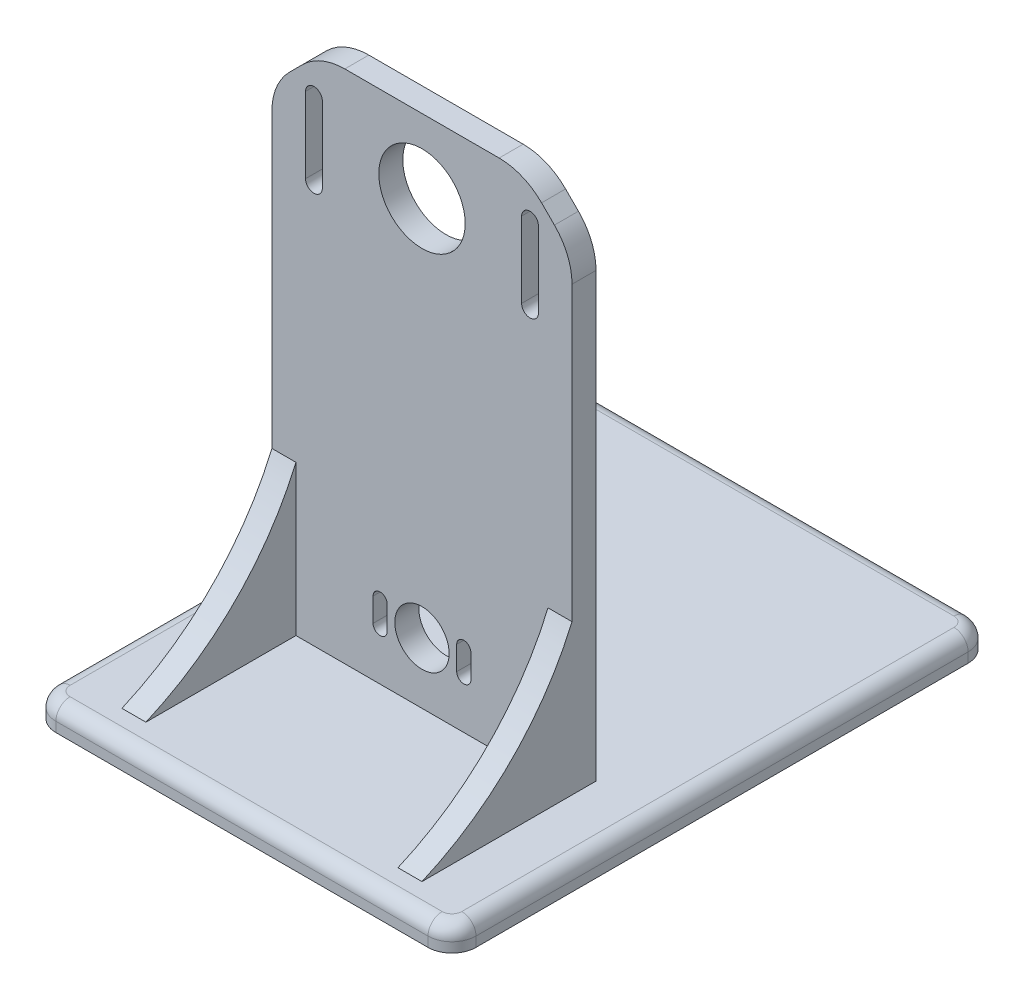
from build123d import *

# Parameters (mm, degrees)
SKETCH1_W                  = 88.9
SKETCH1_H                  = 114.3
BASE_DEPTH                 = 5.08
SKETCH2_W                  = 63.5
SKETCH2_H                  = 5.08
FACE_PLATE_DEPTH           = 114.3
SKETCH3_W                  = 5.08
SKETCH3_H                  = 31.75
BACK_FACE_SUPPORTS_DEPTH   = 31.75
BF_EXTRA_SUPPORT_CUT_DEPTH = 153.722450543
SKETCH5_R                  = 9.144
SKETCH5_R_2                = 5.75
FACE_HOLES_DEPTH           = 149.437956399
BASE_CORNER_FILLET_R       = 5.08
SKETCH9_W                  = 63.5
SKETCH9_H                  = 5.284393904
BASE_REFINE_DEPTH          = 149.437956399
FACE_REFINE_CUT_DEPTH      = 145.222223774
TOP_FACE_FILLET_R          = 12.7
NAME_DEPTH                 = 0.508
BOTTOM_CUT_DEPTH           = 2.54
FILLET1_R                  = 3
CUT_EXTRUDE1_DEPTH         = 0.4


with BuildPart() as part:
    # Sketch1 → Base (new body)
    with BuildSketch(Plane(origin=(0, 0, 0), x_dir=(1, 0, 0), z_dir=(0, 1, 0))):
        Rectangle(SKETCH1_W, SKETCH1_H)
    extrude(amount=BASE_DEPTH)

    # Sketch2 → Face Plate (add)
    with BuildSketch(Plane(origin=(0, 5.08, 0), x_dir=(1, 0, 0), z_dir=(0, 1, 0))):
        with Locations((0, -16.51)):
            Rectangle(SKETCH2_W, SKETCH2_H)
    extrude(amount=FACE_PLATE_DEPTH)

    # Sketch3 → Back Face Supports (add)
    with BuildSketch(Plane.XY.offset(19.05)):
        with Locations((-29.21, 20.955)):
            Rectangle(SKETCH3_W, SKETCH3_H)
        with Locations((29.21, 20.955)):
            Rectangle(SKETCH3_W, SKETCH3_H)
    extrude(amount=BACK_FACE_SUPPORTS_DEPTH)

    # Sketch4 → BF Extra Support Cut (cut, through all)
    with BuildSketch(Plane(origin=(31.75, 0, 0), x_dir=(0, 0, -1), z_dir=(1, 0, 0))):
        with BuildLine():
            Line((-50.8, 5.08), (-50.8, 36.83))
            Line((-50.8, 36.83), (-19.05, 36.83))
            ThreePointArc((-19.05, 36.83), (-31.87137494, 17.90137494), (-50.8, 5.08))
        make_face()
    extrude(amount=-BF_EXTRA_SUPPORT_CUT_DEPTH, mode=Mode.SUBTRACT)

    # Sketch5 → Face Holes (cut, through all)
    with BuildSketch(Plane.XY.offset(19.05)):
        with Locations((0, 98.498)):
            Circle(SKETCH5_R)
        with Locations((0, 17.98)):
            Circle(SKETCH5_R_2)
        with BuildLine():
            Line((-10.35, 15.48), (-10.35, 20.48))
            ThreePointArc((-10.35, 20.48), (-8.85, 21.98), (-7.35, 20.48))
            Line((-7.35, 20.48), (-7.35, 15.48))
            ThreePointArc((-7.35, 15.48), (-8.85, 13.98), (-10.35, 15.48))
        make_face()
        with BuildLine():
            Line((10.35, 20.48), (10.35, 15.48))
            ThreePointArc((10.35, 15.48), (8.85, 13.98), (7.35, 15.48))
            Line((7.35, 15.48), (7.35, 20.48))
            ThreePointArc((7.35, 20.48), (8.85, 21.98), (10.35, 20.48))
        make_face()
        with BuildLine():
            Line((24.638, 105.83), (24.638, 89.83))
            ThreePointArc((24.638, 89.83), (22.86, 88.052), (21.082, 89.83))
            Line((21.082, 89.83), (21.082, 105.83))
            ThreePointArc((21.082, 105.83), (22.86, 107.608), (24.638, 105.83))
        make_face()
        with BuildLine():
            Line((-21.082, 105.83), (-21.082, 89.83))
            ThreePointArc((-21.082, 89.83), (-22.86, 88.052), (-24.638, 89.83))
            Line((-24.638, 89.83), (-24.638, 105.83))
            ThreePointArc((-24.638, 105.83), (-22.86, 107.608), (-21.082, 105.83))
        make_face()
    extrude(amount=-FACE_HOLES_DEPTH, mode=Mode.SUBTRACT)

    # Base Corner Fillet
    base_corner_fillet_edges = [part.edges().sort_by_distance(p)[0] for p in [
        (-44.45, 2.54, -57.15),
        (44.45, 2.54, -57.15),
        (44.45, 2.54, 57.15),
        (-44.45, 2.54, 57.15),
    ]]
    fillet(base_corner_fillet_edges, radius=BASE_CORNER_FILLET_R)

    # Sketch9 → Base Refine (cut, through all)
    with BuildSketch(Plane.XY.offset(19.05)):
        with Locations((0, 116.737803048)):
            Rectangle(SKETCH9_W, SKETCH9_H)
    extrude(amount=-BASE_REFINE_DEPTH, mode=Mode.SUBTRACT)

    # Sketch10 → Face Refine Cut (cut, through all)
    with BuildSketch(Plane.XY.offset(19.05)):
        Polygon((-31.75, 103.935606096), (-21.59, 114.095606096), (-31.75, 114.095606096), align=None)
        Polygon((21.59, 114.095606096), (31.75, 103.935606096), (31.75, 114.095606096), align=None)
    extrude(amount=-FACE_REFINE_CUT_DEPTH, mode=Mode.SUBTRACT)

    # Top Face Fillet
    top_face_fillet_edges = [part.edges().sort_by_distance(p)[0] for p in [
        (-21.59, 114.095606096, 16.51),
        (-31.75, 103.935606096, 16.51),
        (21.59, 114.095606096, 16.51),
        (31.75, 103.935606096, 16.51),
    ]]
    fillet(top_face_fillet_edges, radius=TOP_FACE_FILLET_R)

    # Sketch16 → Name (cut)
    # profile 1 of 7: a face of its own
    with BuildSketch(Plane(origin=(0, 0, 13.97), x_dir=(-1, 0, 0), z_dir=(0, 0, -1))):
        with BuildLine():
            Line((-12.471962698, 66.783231191), (-10.945308385, 66.863581418))
            Line((-10.945308385, 66.863581418), (-10.945308385, 63.723645202))
            add(Edge.make_bspline(
                [(-10.945308385, 63.723645202), (-10.894257328, 63.788353863), (-10.795330555, 63.913746351), (-10.630590311, 64.078338575), (-10.462433111, 64.219764676), (-10.286710754, 64.333469949), (-10.105483231, 64.42249593), (-9.91933376, 64.487057121), (-9.727050145, 64.526336575), (-9.597111789, 64.531050085), (-9.531646578, 64.533424834)],
                knots=[0, 0, 0, 0, 1.168822825, 2.264945695, 3.29838973, 4.281884798, 5.227492406, 6.157224656, 7.071577621, 8, 8, 8, 8], degree=3))
            add(Edge.make_bspline(
                [(-9.531646578, 64.533424834), (-9.470396033, 64.531238682), (-9.350344183, 64.526953797), (-9.174871834, 64.493587463), (-9.008877972, 64.437586153), (-8.906999532, 64.382576052), (-8.856202482, 64.355147768)],
                knots=[0, 0, 0, 0, 1.039340968, 2.037121574, 3.02129996, 4, 4, 4, 4], degree=3))
            add(Edge.make_bspline(
                [(-8.856202482, 64.355147768), (-8.817352658, 64.328507232), (-8.736854496, 64.273307131), (-8.634346067, 64.158251635), (-8.538703847, 64.020491366), (-8.453056013, 63.858009515), (-8.381659419, 63.674209992), (-8.331090551, 63.472206503), (-8.298574037, 63.254313369), (-8.295395005, 63.103565493), (-8.293750893, 63.025602605)],
                knots=[0, 0, 0, 0, 0.750912499, 1.555916367, 2.445224318, 3.430216918, 4.485397544, 5.590808741, 6.754028823, 8, 8, 8, 8], degree=3))
            Line((-8.293750893, 63.025602605), (-8.293750893, 61.177547383))
            add(Edge.make_bspline(
                [(-8.293750893, 61.177547383), (-8.292599789, 61.149823314), (-8.290427929, 61.097514542), (-8.273080475, 61.024859657), (-8.244228053, 60.963798639), (-8.202314441, 60.914959785), (-8.146896621, 60.879007422), (-8.078688841, 60.85440263), (-7.9976614, 60.839724113), (-7.939356415, 60.838151491), (-7.908320897, 60.837314391)],
                knots=[0, 0, 0, 0, 1.12071811, 2.114530431, 3.000515668, 3.828803179, 4.683494856, 5.642662726, 6.745198504, 8, 8, 8, 8], degree=3))
            Line((-7.908320897, 60.837314391), (-7.570598849, 60.837314391))
            Line((-7.570598849, 60.837314391), (-7.570598849, 60.515913482))
            Line((-7.570598849, 60.515913482), (-9.740054979, 60.515913482))
            Line((-9.740054979, 60.515913482), (-9.740054979, 60.837314391))
            Line((-9.740054979, 60.837314391), (-9.50025977, 60.837314391))
            add(Edge.make_bspline(
                [(-9.50025977, 60.837314391), (-9.457916154, 60.83792309), (-9.380378663, 60.839037709), (-9.274482674, 60.855356026), (-9.188823193, 60.880117697), (-9.12191949, 60.917505304), (-9.073142169, 60.967546004), (-9.040504723, 61.028620777), (-9.019485734, 61.099604595), (-9.017795933, 61.150598833), (-9.016902936, 61.177547383)],
                knots=[0, 0, 0, 0, 1.493786353, 2.735346083, 3.772994554, 4.627205296, 5.411016843, 6.204796016, 7.051301753, 8, 8, 8, 8], degree=3))
            Line((-9.016902936, 61.177547383), (-9.016902936, 63.02309166))
            add(Edge.make_bspline(
                [(-9.016902936, 63.02309166), (-9.01753335, 63.062465508), (-9.018756717, 63.138873397), (-9.030907469, 63.250341838), (-9.04758296, 63.355452634), (-9.072653257, 63.453853427), (-9.10550589, 63.545059543), (-9.145672486, 63.629744916), (-9.193787985, 63.707588013), (-9.247404138, 63.779645438), (-9.30768241, 63.842611799), (-9.370724854, 63.89987233), (-9.44033467, 63.944981148), (-9.511934329, 63.985707156), (-9.589145592, 64.013451986), (-9.66963219, 64.035405559), (-9.754188773, 64.049797862), (-9.812396931, 64.050812064), (-9.841748235, 64.051323472)],
                knots=[0, 0, 0, 0, 1.274887751, 2.474014809, 3.628403139, 4.719955398, 5.757655449, 6.764162974, 7.749917439, 8.717800625, 9.667185997, 10.570042641, 11.468615002, 12.348172181, 13.231897901, 14.116454972, 15.050227598, 16, 16, 16, 16], degree=3))
            add(Edge.make_bspline(
                [(-9.841748235, 64.051323472), (-9.887885352, 64.049136093), (-9.979719402, 64.044782205), (-10.1153995, 64.01760687), (-10.244466578, 63.966384602), (-10.369730913, 63.900565325), (-10.487158058, 63.813105937), (-10.594532482, 63.70462248), (-10.692711481, 63.576540839), (-10.779887866, 63.431615749), (-10.854836257, 63.275599968), (-10.905097692, 63.110322054), (-10.940362454, 62.941724196), (-10.943656795, 62.827001485), (-10.945308385, 62.769486256)],
                knots=[0, 0, 0, 0, 0.887841407, 1.767212146, 2.646288066, 3.550259555, 4.482464879, 5.450143428, 6.477428723, 7.579135646, 8.699130984, 9.796447035, 10.895267977, 12, 12, 12, 12], degree=3))
            Line((-10.945308385, 62.769486256), (-10.945308385, 61.218977969))
            add(Edge.make_bspline(
                [(-10.945308385, 61.218977969), (-10.944821988, 61.186631742), (-10.943922311, 61.126801667), (-10.925567048, 61.044660193), (-10.899034194, 60.976242757), (-10.858746567, 60.921626579), (-10.80348158, 60.882565704), (-10.735654836, 60.855382689), (-10.653518046, 60.839297048), (-10.59427354, 60.838008085), (-10.562389334, 60.837314391)],
                knots=[0, 0, 0, 0, 1.231192412, 2.277308443, 3.193625701, 4.014386126, 4.825616126, 5.741933384, 6.784753784, 8, 8, 8, 8], degree=3))
            Line((-10.562389334, 60.837314391), (-10.222156341, 60.837314391))
            Line((-10.222156341, 60.837314391), (-10.222156341, 60.515913482))
            Line((-10.222156341, 60.515913482), (-12.391612471, 60.515913482))
            Line((-12.391612471, 60.515913482), (-12.391612471, 60.837314391))
            Line((-12.391612471, 60.837314391), (-12.140518012, 60.837314391))
            add(Edge.make_bspline(
                [(-12.140518012, 60.837314391), (-12.100695553, 60.838454998), (-12.02687582, 60.840569366), (-11.92499666, 60.857182378), (-11.841376786, 60.886677704), (-11.775040047, 60.929436905), (-11.725159358, 60.985917508), (-11.691655206, 61.055443098), (-11.671011482, 61.137036021), (-11.669347325, 61.195404073), (-11.668460428, 61.226510803)],
                knots=[0, 0, 0, 0, 1.353048536, 2.508174669, 3.493670835, 4.345741896, 5.161920022, 6.020612883, 6.945103361, 8, 8, 8, 8], degree=3))
            Line((-11.668460428, 61.226510803), (-11.668460428, 65.958385891))
            add(Edge.make_bspline(
                [(-11.668460428, 65.958385891), (-11.670167181, 65.998249447), (-11.673364623, 66.072930089), (-11.696362911, 66.178190019), (-11.739769625, 66.266374635), (-11.799122848, 66.338916373), (-11.874062441, 66.396078144), (-11.965350285, 66.433937668), (-12.070577256, 66.458726848), (-12.145795726, 66.460754294), (-12.185715014, 66.461830283)],
                knots=[0, 0, 0, 0, 1.159054976, 2.171381103, 3.107337103, 3.989130834, 4.874944922, 5.817599636, 6.841775591, 8, 8, 8, 8], degree=3))
            Line((-12.185715014, 66.461830283), (-12.471962698, 66.461830283))
            Line((-12.471962698, 66.461830283), (-12.471962698, 66.783231191))
        make_face()
    # profile 2 of 7: a face of its own
    with BuildSketch(Plane(origin=(0, 0, 13.97), x_dir=(-1, 0, 0), z_dir=(0, 0, -1))):
        with BuildLine():
            Line((-4.43945094, 66.863581418), (-4.059042834, 66.863581418))
            Line((-4.059042834, 66.863581418), (-1.892097649, 61.188846634))
            add(Edge.make_bspline(
                [(-1.892097649, 61.188846634), (-1.879975161, 61.160779003), (-1.856694173, 61.106875696), (-1.808467999, 61.034663792), (-1.75263499, 60.972420461), (-1.685596331, 60.923612974), (-1.611986593, 60.882767597), (-1.527455131, 60.858294235), (-1.435554812, 60.839014928), (-1.37077757, 60.837895181), (-1.337178893, 60.837314391)],
                knots=[0, 0, 0, 0, 1.039787226, 1.996889935, 2.945563617, 3.872445737, 4.810232727, 5.797866669, 6.857796924, 8, 8, 8, 8], degree=3))
            Line((-1.337178893, 60.837314391), (-1.142580687, 60.837314391))
            Line((-1.142580687, 60.837314391), (-1.142580687, 60.515913482))
            Line((-1.142580687, 60.515913482), (-3.713787952, 60.515913482))
            Line((-3.713787952, 60.515913482), (-3.713787952, 60.837314391))
            Line((-3.713787952, 60.837314391), (-3.509145967, 60.837314391))
            add(Edge.make_bspline(
                [(-3.509145967, 60.837314391), (-3.447135025, 60.83791634), (-3.332486718, 60.839029249), (-3.175680056, 60.855697651), (-3.046105563, 60.878404117), (-2.973960624, 60.908995482), (-2.941672489, 60.922686507)],
                knots=[0, 0, 0, 0, 1.28614417, 2.377874675, 3.274025287, 4, 4, 4, 4], degree=3))
            add(Edge.make_bspline(
                [(-2.941672489, 60.922686507), (-2.924728275, 60.933163254), (-2.891820888, 60.953510162), (-2.853871541, 60.997031661), (-2.833195348, 61.050367684), (-2.830221755, 61.087821545), (-2.828679982, 61.107240934)],
                knots=[0, 0, 0, 0, 1.044845995, 2.029197152, 2.978161746, 4, 4, 4, 4], degree=3))
            add(Edge.make_bspline(
                [(-2.828679982, 61.107240934), (-2.830049189, 61.132577416), (-2.83291257, 61.185562827), (-2.850755805, 61.235569479), (-2.86006679, 61.261664027)],
                knots=[0, 0, 0, 0, 0.9563569, 2, 2, 2, 2], degree=3))
            Line((-2.86006679, 61.261664027), (-3.373554959, 62.605019385))
            Line((-3.373554959, 62.605019385), (-5.780295353, 62.605019385))
            Line((-5.780295353, 62.605019385), (-6.084119649, 61.834159395))
            add(Edge.make_bspline(
                [(-6.084119649, 61.834159395), (-6.101058416, 61.785805805), (-6.132770852, 61.695279133), (-6.168178043, 61.565350678), (-6.191439424, 61.451218904), (-6.195330158, 61.379763499), (-6.197112156, 61.347036143)],
                knots=[0, 0, 0, 0, 1.224040328, 2.291625076, 3.217545626, 4, 4, 4, 4], degree=3))
            add(Edge.make_bspline(
                [(-6.197112156, 61.347036143), (-6.194624859, 61.312823792), (-6.189726296, 61.245444886), (-6.152183063, 61.148406337), (-6.089717443, 61.06131834), (-6.006244844, 60.981063435), (-5.898079908, 60.915634313), (-5.767247172, 60.870312771), (-5.615887051, 60.84071652), (-5.507598372, 60.838494237), (-5.450106139, 60.837314391)],
                knots=[0, 0, 0, 0, 0.81354721, 1.602226087, 2.440081589, 3.349586742, 4.342853265, 5.424428202, 6.632586778, 8, 8, 8, 8], degree=3))
            Line((-5.450106139, 60.837314391), (-5.240442266, 60.837314391))
            Line((-5.240442266, 60.837314391), (-5.240442266, 60.515913482))
            Line((-5.240442266, 60.515913482), (-7.490248622, 60.515913482))
            Line((-7.490248622, 60.515913482), (-7.490248622, 60.837314391))
            add(Edge.make_bspline(
                [(-7.490248622, 60.837314391), (-7.431931207, 60.839027799), (-7.32071169, 60.842295511), (-7.163168178, 60.872625901), (-7.0241484, 60.922137388), (-6.901370072, 60.99548198), (-6.791523133, 61.098821921), (-6.693323745, 61.237424697), (-6.59522505, 61.408452926), (-6.541239011, 61.538375266), (-6.512235703, 61.608174381)],
                knots=[0, 0, 0, 0, 1.036060294, 1.975912788, 2.839911673, 3.647735987, 4.500737518, 5.500873586, 6.657376306, 8, 8, 8, 8], degree=3))
            Line((-6.512235703, 61.608174381), (-4.43945094, 66.863581418))
        make_face()
        Polygon((-4.557465336, 65.70603596), (-5.653492651, 62.926420293), (-3.496591245, 62.926420293), align=None, mode=Mode.SUBTRACT)
    # profile 3 of 7: a face of its own
    with BuildSketch(Plane(origin=(0, 0, 13.97), x_dir=(-1, 0, 0), z_dir=(0, 0, -1))):
        with BuildLine():
            add(Edge.make_bspline(
                [(0.269825648, 64.453074607), (0.285288181, 64.386695369), (0.31586485, 64.255432537), (0.34693863, 64.05852004), (0.372308759, 63.866037227), (0.38018452, 63.738778513), (0.384073627, 63.675937255)],
                knots=[0, 0, 0, 0, 1.039429647, 2.055439057, 3.039761968, 4, 4, 4, 4], degree=3))
            add(Edge.make_bspline(
                [(0.384073627, 63.675937255), (0.431209917, 63.748916137), (0.521285084, 63.888375244), (0.671962417, 64.07191883), (0.8254744, 64.222944837), (0.985110786, 64.339957128), (1.151262209, 64.426270994), (1.322944174, 64.488467605), (1.50232951, 64.526125488), (1.624302497, 64.530972923), (1.685998399, 64.533424834)],
                knots=[0, 0, 0, 0, 1.273398553, 2.43340293, 3.475203942, 4.424237738, 5.324750169, 6.212049577, 7.095625871, 8, 8, 8, 8], degree=3))
            add(Edge.make_bspline(
                [(1.685998399, 64.533424834), (1.752398373, 64.530633357), (1.885575424, 64.525034549), (2.081914486, 64.475856376), (2.273912181, 64.398408666), (2.45888435, 64.290004787), (2.634887486, 64.153419476), (2.791711938, 63.983613843), (2.933728416, 63.787831682), (3.053427441, 63.564200576), (3.154878882, 63.320611793), (3.22537803, 63.058075688), (3.269606794, 62.78061728), (3.274286904, 62.59054548), (3.2766818, 62.493282351)],
                knots=[0, 0, 0, 0, 0.832050729, 1.668826898, 2.523985918, 3.42281591, 4.350360853, 5.308783652, 6.312937571, 7.377393462, 8.484163678, 9.61664467, 10.780394584, 12, 12, 12, 12], degree=3))
            add(Edge.make_bspline(
                [(3.2766818, 62.493282351), (3.275095729, 62.415358686), (3.271990823, 62.262814601), (3.244655791, 62.039447246), (3.202085397, 61.826751159), (3.137737158, 61.626074351), (3.060060119, 61.435214036), (2.959974774, 61.257836641), (2.846817035, 61.088533528), (2.756099483, 60.987381488), (2.710463794, 60.936496702)],
                knots=[0, 0, 0, 0, 1.100824048, 2.154983319, 3.175696488, 4.161457331, 5.129115152, 6.082112712, 7.035202026, 8, 8, 8, 8], degree=3))
            add(Edge.make_bspline(
                [(2.710463794, 60.936496702), (2.671036498, 60.896361712), (2.593845236, 60.817784917), (2.46725583, 60.715360594), (2.33475827, 60.629760367), (2.196978847, 60.558729549), (2.053223126, 60.502774982), (1.903075953, 60.464594865), (1.747533829, 60.439329853), (1.641739645, 60.436830929), (1.58807156, 60.435563255)],
                knots=[0, 0, 0, 0, 1.065850518, 2.086735739, 3.079113295, 4.051245272, 5.020622088, 5.996146755, 6.983469966, 8, 8, 8, 8], degree=3))
            add(Edge.make_bspline(
                [(1.58807156, 60.435563255), (1.527625607, 60.438013301), (1.408129255, 60.442856827), (1.233794916, 60.480270809), (1.068509287, 60.541150547), (0.912241842, 60.626300734), (0.765815857, 60.737005484), (0.629039036, 60.871904301), (0.498215295, 61.02799836), (0.422951263, 61.145650192), (0.384073627, 61.206423246)],
                knots=[0, 0, 0, 0, 0.966758756, 1.911197374, 2.839323053, 3.777399657, 4.748533171, 5.766835357, 6.846458785, 8, 8, 8, 8], degree=3))
            Line((0.384073627, 61.206423246), (0.384073627, 59.595652288))
            add(Edge.make_bspline(
                [(0.384073627, 59.595652288), (0.385328998, 59.566686891), (0.387662962, 59.512834928), (0.403158083, 59.438380767), (0.431550668, 59.376385217), (0.461410946, 59.3463832), (0.475723104, 59.332003106)],
                knots=[0, 0, 0, 0, 1.207808368, 2.245536299, 3.159078068, 4, 4, 4, 4], degree=3))
            add(Edge.make_bspline(
                [(0.475723104, 59.332003106), (0.496961078, 59.31647985), (0.540666323, 59.284534822), (0.618970507, 59.25216806), (0.70834885, 59.233475833), (0.771497293, 59.231399921), (0.804656846, 59.23030985)],
                knots=[0, 0, 0, 0, 0.896289512, 1.844458034, 2.868114502, 4, 4, 4, 4], degree=3))
            Line((0.804656846, 59.23030985), (1.10722567, 59.23030985))
            Line((1.10722567, 59.23030985), (1.10722567, 58.908908942))
            Line((1.10722567, 58.908908942), (-1.06223046, 58.908908942))
            Line((-1.06223046, 58.908908942), (-1.06223046, 59.23030985))
            Line((-1.06223046, 59.23030985), (-0.759661636, 59.23030985))
            add(Edge.make_bspline(
                [(-0.759661636, 59.23030985), (-0.726963782, 59.231262277), (-0.665427442, 59.233054714), (-0.579175237, 59.246441437), (-0.505064832, 59.269356753), (-0.44499346, 59.304090376), (-0.396631023, 59.3455708), (-0.363915877, 59.395976276), (-0.341954352, 59.45163061), (-0.34005308, 59.491233638), (-0.339078417, 59.511535645)],
                knots=[0, 0, 0, 0, 1.379863346, 2.596859678, 3.675146504, 4.632774991, 5.508690266, 6.336796759, 7.147379235, 8, 8, 8, 8], degree=3))
            Line((-0.339078417, 59.511535645), (-0.339078417, 63.526536051))
            add(Edge.make_bspline(
                [(-0.339078417, 63.526536051), (-0.34035796, 63.5698278), (-0.342749737, 63.650750579), (-0.370556876, 63.762283387), (-0.415245758, 63.854770356), (-0.470683615, 63.914670927), (-0.524834513, 63.952155015), (-0.575826228, 63.975032801), (-0.63481344, 63.99671768), (-0.703161927, 64.01351101), (-0.779727101, 64.02885086), (-0.865720612, 64.039897766), (-0.960864547, 64.047002189), (-1.027485728, 64.049842285), (-1.06223046, 64.051323472)],
                knots=[0, 0, 0, 0, 1.501362446, 2.80641061, 3.964093312, 5.034347703, 5.599087458, 6.243088378, 6.969936893, 7.781210756, 8.685323185, 9.68285672, 10.791547646, 12, 12, 12, 12], degree=3))
            Line((-1.06223046, 64.051323472), (-1.06223046, 64.37272438))
            Line((-1.06223046, 64.37272438), (0.269825648, 64.453074607))
        make_face()
        with BuildLine():
            add(Edge.make_bspline(
                [(1.481356414, 64.131673699), (1.44359489, 64.130615699), (1.369187473, 64.128530956), (1.259906928, 64.107451172), (1.155043168, 64.073821351), (1.055253688, 64.024924591), (0.958997181, 63.964749902), (0.86823883, 63.889344151), (0.781311454, 63.801248571), (0.700240077, 63.699128745), (0.624404239, 63.585843808), (0.560797513, 63.45838986), (0.505055336, 63.320569756), (0.461969273, 63.169653197), (0.426507491, 63.007451761), (0.402082724, 62.832862852), (0.386696299, 62.646309439), (0.384965849, 62.518005491), (0.384073627, 62.451851765)],
                knots=[0, 0, 0, 0, 0.810044955, 1.596157845, 2.38052233, 3.168328491, 3.97612713, 4.812657516, 5.695958019, 6.629271728, 7.608815696, 8.617603778, 9.682283829, 10.796989732, 11.983260504, 13.24526791, 14.579655631, 16, 16, 16, 16], degree=3))
            add(Edge.make_bspline(
                [(0.384073627, 62.451851765), (0.38508558, 62.385288717), (0.387041777, 62.256616366), (0.400668226, 62.070020699), (0.424092848, 61.896741126), (0.457551763, 61.736676727), (0.501568999, 61.590624626), (0.554061362, 61.457418676), (0.616777182, 61.33786595), (0.688680677, 61.231176923), (0.768933419, 61.13905348), (0.854138616, 61.058506559), (0.944671068, 60.989868695), (1.041948173, 60.935332416), (1.142679167, 60.88984678), (1.249901398, 60.860486531), (1.361768637, 60.840668451), (1.438580907, 60.838444051), (1.477589998, 60.837314391)],
                knots=[0, 0, 0, 0, 1.457270853, 2.817035441, 4.093364308, 5.282985776, 6.393140695, 7.429294108, 8.412911582, 9.343011843, 10.239422711, 11.082057933, 11.906667326, 12.719226751, 13.519292525, 14.319725458, 15.14667302, 16, 16, 16, 16], degree=3))
            add(Edge.make_bspline(
                [(1.477589998, 60.837314391), (1.513645644, 60.838139406), (1.584471692, 60.83976003), (1.687208449, 60.85654559), (1.783645665, 60.882942415), (1.873880985, 60.919255078), (1.957049887, 60.967646373), (2.034094618, 61.025443439), (2.104404856, 61.094450051), (2.144855005, 61.146897577), (2.165588816, 61.173780966)],
                knots=[0, 0, 0, 0, 1.084037303, 2.129432885, 3.122244742, 4.087937627, 5.046875604, 6.0088674, 6.97939144, 8, 8, 8, 8], degree=3))
            add(Edge.make_bspline(
                [(2.165588816, 61.173780966), (2.190194044, 61.212686353), (2.240425743, 61.292111904), (2.30337188, 61.422873349), (2.355616287, 61.56694494), (2.399310875, 61.723482564), (2.433048994, 61.892616094), (2.456645253, 62.074225837), (2.470154127, 62.268764745), (2.472150999, 62.402867093), (2.473179529, 62.471939322)],
                knots=[0, 0, 0, 0, 0.81574162, 1.665340782, 2.566854776, 3.530083103, 4.544405102, 5.62220874, 6.775268701, 8, 8, 8, 8], degree=3))
            add(Edge.make_bspline(
                [(2.473179529, 62.471939322), (2.472762218, 62.543948276), (2.471958273, 62.68267261), (2.457326605, 62.882465682), (2.436616676, 63.066515524), (2.407685554, 63.234699786), (2.36679932, 63.386324707), (2.319662856, 63.522780381), (2.264158125, 63.643960977), (2.1976054, 63.747902893), (2.125446632, 63.838288294), (2.047334957, 63.915852998), (1.965704833, 63.983505153), (1.878349125, 64.038076589), (1.785663909, 64.079617054), (1.688826829, 64.110015127), (1.586640666, 64.127985232), (1.516999706, 64.130424992), (1.481356414, 64.131673699)],
                knots=[0, 0, 0, 0, 1.593424832, 3.069712662, 4.431201921, 5.692152976, 6.842517797, 7.903004678, 8.88506815, 9.784455699, 10.627818321, 11.439982389, 12.216834349, 12.969908626, 13.711965069, 14.459034101, 15.211310449, 16, 16, 16, 16], degree=3))
        make_face(mode=Mode.SUBTRACT)
    # profile 4 of 7: a face of its own
    with BuildSketch(Plane(origin=(0, 0, 13.97), x_dir=(-1, 0, 0), z_dir=(0, 0, -1))):
        with BuildLine():
            Line((4.08018407, 66.863581418), (5.606838384, 66.943931645))
            Line((5.606838384, 66.943931645), (5.606838384, 62.503326129))
            Line((5.606838384, 62.503326129), (6.866077098, 63.619441001))
            add(Edge.make_bspline(
                [(6.866077098, 63.619441001), (6.893100414, 63.645224738), (6.942576678, 63.69243149), (7.00082503, 63.764538209), (7.03969314, 63.831072134), (7.045506925, 63.875618543), (7.048120581, 63.895644907)],
                knots=[0, 0, 0, 0, 1.32204681, 2.420500026, 3.289917145, 4, 4, 4, 4], degree=3))
            add(Edge.make_bspline(
                [(7.048120581, 63.895644907), (7.046985992, 63.910916647), (7.044706553, 63.941598233), (7.023571429, 63.984523805), (6.986781916, 64.019642612), (6.956514477, 64.036946171), (6.940149963, 64.046301583)],
                knots=[0, 0, 0, 0, 0.931054332, 1.870528317, 2.848671379, 4, 4, 4, 4], degree=3))
            add(Edge.make_bspline(
                [(6.940149963, 64.046301583), (6.90907621, 64.059050001), (6.840319995, 64.087258148), (6.718580743, 64.108948759), (6.573274065, 64.127414475), (6.467344345, 64.130183572), (6.410340654, 64.131673699)],
                knots=[0, 0, 0, 0, 0.744513932, 1.647369692, 2.733985035, 4, 4, 4, 4], degree=3))
            Line((6.410340654, 64.131673699), (6.410340654, 64.453074607))
            Line((6.410340654, 64.453074607), (8.499446557, 64.453074607))
            Line((8.499446557, 64.453074607), (8.499446557, 64.131673699))
            add(Edge.make_bspline(
                [(8.499446557, 64.131673699), (8.449168394, 64.128541057), (8.351677562, 64.122466772), (8.210016124, 64.10312017), (8.077681334, 64.077657699), (7.954456669, 64.043116615), (7.840237433, 64.00255276), (7.735782487, 63.952735381), (7.638606331, 63.898394414), (7.581193534, 63.853702379), (7.552820444, 63.83161582)],
                knots=[0, 0, 0, 0, 1.197071077, 2.321155953, 3.396101095, 4.397706835, 5.360627387, 6.272887443, 7.146470438, 8, 8, 8, 8], degree=3))
            Line((7.552820444, 63.83161582), (6.650135863, 63.030624494))
            Line((6.650135863, 63.030624494), (8.114016561, 61.01182504))
            add(Edge.make_bspline(
                [(8.114016561, 61.01182504), (8.140273027, 60.984502733), (8.194359328, 60.928220882), (8.307930431, 60.875066866), (8.443175175, 60.842752466), (8.541899126, 60.839213156), (8.594862451, 60.837314391)],
                knots=[0, 0, 0, 0, 0.854718675, 1.760654718, 2.798638323, 4, 4, 4, 4], degree=3))
            Line((8.594862451, 60.837314391), (8.820847465, 60.837314391))
            Line((8.820847465, 60.837314391), (8.820847465, 60.515913482))
            Line((8.820847465, 60.515913482), (6.651391335, 60.515913482))
            Line((6.651391335, 60.515913482), (6.651391335, 60.837314391))
            Line((6.651391335, 60.837314391), (6.854777847, 60.837314391))
            add(Edge.make_bspline(
                [(6.854777847, 60.837314391), (6.889959062, 60.837618176), (6.953722857, 60.838168769), (7.04003362, 60.846060746), (7.108193294, 60.855704962), (7.159547883, 60.87204668), (7.196038361, 60.892387613), (7.220889407, 60.914400885), (7.238491458, 60.937715922), (7.240492329, 60.95549112), (7.241463315, 60.964117093)],
                knots=[0, 0, 0, 0, 1.932048188, 3.501718925, 4.76052542, 5.705802126, 6.447338183, 7.033573909, 7.531011419, 8, 8, 8, 8], degree=3))
            add(Edge.make_bspline(
                [(7.241463315, 60.964117093), (7.23952351, 60.982241913), (7.235342586, 61.021306918), (7.211537566, 61.052731897), (7.198777257, 61.069576766)],
                knots=[0, 0, 0, 0, 0.927931271, 2, 2, 2, 2], degree=3))
            Line((7.198777257, 61.069576766), (6.112793719, 62.553545021))
            Line((6.112793719, 62.553545021), (5.606838384, 62.102830466))
            Line((5.606838384, 62.102830466), (5.606838384, 61.099708101))
            add(Edge.make_bspline(
                [(5.606838384, 61.099708101), (5.60754251, 61.080310642), (5.60887354, 61.043643093), (5.625930235, 60.992604071), (5.654111822, 60.949525135), (5.680271664, 60.928346527), (5.693465972, 60.917664618)],
                knots=[0, 0, 0, 0, 1.103937104, 2.086802585, 3.035035642, 4, 4, 4, 4], degree=3))
            add(Edge.make_bspline(
                [(5.693465972, 60.917664618), (5.715688336, 60.905103677), (5.762058657, 60.878893374), (5.8432332, 60.854840053), (5.93519155, 60.839768001), (6.000566726, 60.838160136), (6.034954437, 60.837314391)],
                knots=[0, 0, 0, 0, 0.859744497, 1.793986879, 2.839624659, 4, 4, 4, 4], degree=3))
            Line((6.034954437, 60.837314391), (6.329990427, 60.837314391))
            Line((6.329990427, 60.837314391), (6.329990427, 60.515913482))
            Line((6.329990427, 60.515913482), (4.08018407, 60.515913482))
            Line((4.08018407, 60.515913482), (4.08018407, 60.837314391))
            Line((4.08018407, 60.837314391), (4.444271036, 60.837314391))
            add(Edge.make_bspline(
                [(4.444271036, 60.837314391), (4.479049991, 60.838642793), (4.544430991, 60.841140059), (4.636027025, 60.856094371), (4.712875139, 60.885468319), (4.77637357, 60.924464609), (4.825012577, 60.974453398), (4.859551964, 61.032095576), (4.880926005, 61.097411483), (4.882740206, 61.143478783), (4.88368634, 61.167503605)],
                knots=[0, 0, 0, 0, 1.343298843, 2.525269173, 3.563348147, 4.500061708, 5.379732763, 6.227525947, 7.075626917, 8, 8, 8, 8], degree=3))
            Line((4.88368634, 61.167503605), (4.88368634, 66.130385596))
            add(Edge.make_bspline(
                [(4.88368634, 66.130385596), (4.882487381, 66.160705554), (4.880232993, 66.21771576), (4.857020362, 66.29668471), (4.819240229, 66.364020579), (4.781803772, 66.396628584), (4.763161, 66.412866863)],
                knots=[0, 0, 0, 0, 1.139074394, 2.141786135, 3.074638449, 4, 4, 4, 4], degree=3))
            add(Edge.make_bspline(
                [(4.763161, 66.412866863), (4.732015961, 66.433001442), (4.668183089, 66.474267983), (4.555381461, 66.513121821), (4.429170791, 66.539195292), (4.339385644, 66.541154392), (4.292358888, 66.54218051)],
                knots=[0, 0, 0, 0, 0.894044615, 1.832376466, 2.864664094, 4, 4, 4, 4], degree=3))
            Line((4.292358888, 66.54218051), (4.08018407, 66.54218051))
            Line((4.08018407, 66.54218051), (4.08018407, 66.863581418))
        make_face()
    # profile 5 of 7: a face of its own
    with BuildSketch(Plane(origin=(0, 0, 13.97), x_dir=(-1, 0, 0), z_dir=(0, 0, -1))):
        with BuildLine():
            add(Edge.make_bspline(
                [(10.30481572, 66.702880964), (10.333475316, 66.701166954), (10.390246497, 66.697771708), (10.472141986, 66.671116785), (10.549172678, 66.629404569), (10.616179626, 66.569802201), (10.675748129, 66.502793656), (10.717781793, 66.425447364), (10.744236117, 66.342172879), (10.747561884, 66.284169776), (10.749252913, 66.254677354)],
                knots=[0, 0, 0, 0, 0.984626563, 1.950425691, 2.936736457, 3.978791157, 5.020845856, 6.007156623, 6.986713202, 8, 8, 8, 8], degree=3))
            add(Edge.make_bspline(
                [(10.749252913, 66.254677354), (10.748128493, 66.225987831), (10.745915325, 66.169519004), (10.718432132, 66.088887755), (10.678378752, 66.012877787), (10.620313619, 65.947045479), (10.553768106, 65.889985806), (10.477850524, 65.849507781), (10.396195548, 65.822419408), (10.338932793, 65.820170922), (10.309837609, 65.819028466)],
                knots=[0, 0, 0, 0, 0.999946733, 1.968168695, 2.951344777, 3.990437309, 5.020091364, 6.003267447, 6.985460953, 8, 8, 8, 8], degree=3))
            add(Edge.make_bspline(
                [(10.309837609, 65.819028466), (10.280378568, 65.820810859), (10.22296313, 65.824284728), (10.13968694, 65.849093089), (10.063539282, 65.891549589), (9.995392724, 65.949038765), (9.938311637, 66.016968978), (9.895444731, 66.091978321), (9.870792116, 66.173661773), (9.867220337, 66.229826345), (9.865400416, 66.25844377)],
                knots=[0, 0, 0, 0, 1.021863716, 1.991604295, 2.986263642, 4.027760715, 5.069257788, 6.05121452, 7.007039112, 8, 8, 8, 8], degree=3))
            add(Edge.make_bspline(
                [(9.865400416, 66.25844377), (9.867119592, 66.287099071), (9.87052507, 66.343861741), (9.897103839, 66.425820563), (9.938985304, 66.502363517), (9.997153834, 66.570200661), (10.064274473, 66.629408461), (10.140600532, 66.670530754), (10.220952102, 66.697986622), (10.276550875, 66.701231407), (10.30481572, 66.702880964)],
                knots=[0, 0, 0, 0, 0.996270549, 1.973491012, 2.971465681, 4.016434192, 5.07081201, 6.068786679, 7.018225727, 8, 8, 8, 8], degree=3))
        make_face()
    # profile 6 of 7: a face of its own
    with BuildSketch(Plane(origin=(0, 0, 13.97), x_dir=(-1, 0, 0), z_dir=(0, 0, -1))):
        with BuildLine():
            Line((9.2225986, 64.37272438), (10.749252913, 64.453074607))
            Line((10.749252913, 64.453074607), (10.749252913, 61.114773768))
            add(Edge.make_bspline(
                [(10.749252913, 61.114773768), (10.750266482, 61.093355993), (10.752135461, 61.053862504), (10.764331216, 60.998971825), (10.786577035, 60.953200681), (10.809660959, 60.930934375), (10.820814834, 60.920175562)],
                knots=[0, 0, 0, 0, 1.200262611, 2.213234447, 3.136656251, 4, 4, 4, 4], degree=3))
            add(Edge.make_bspline(
                [(10.820814834, 60.920175562), (10.838755086, 60.907183155), (10.874712946, 60.881142319), (10.938284275, 60.857152075), (11.006486798, 60.839444051), (11.054621032, 60.83803895), (11.079442128, 60.837314391)],
                knots=[0, 0, 0, 0, 0.9568273, 1.917780357, 2.926274087, 4, 4, 4, 4], degree=3))
            Line((11.079442128, 60.837314391), (11.552755184, 60.837314391))
            Line((11.552755184, 60.837314391), (11.552755184, 60.515913482))
            Line((11.552755184, 60.515913482), (9.2225986, 60.515913482))
            Line((9.2225986, 60.515913482), (9.2225986, 60.837314391))
            Line((9.2225986, 60.837314391), (9.65448107, 60.837314391))
            add(Edge.make_bspline(
                [(9.65448107, 60.837314391), (9.684319739, 60.837892098), (9.740828445, 60.838986166), (9.818193379, 60.857065726), (9.884744718, 60.882898918), (9.937025044, 60.923248785), (9.978819407, 60.973084494), (10.00562713, 61.034166785), (10.024578306, 61.103591551), (10.02557288, 61.153541445), (10.02610087, 61.180058328)],
                knots=[0, 0, 0, 0, 1.2325627, 2.334237022, 3.274198502, 4.165098485, 5.039491013, 5.938948665, 6.905850397, 8, 8, 8, 8], degree=3))
            Line((10.02610087, 61.180058328), (10.02610087, 63.589309666))
            add(Edge.make_bspline(
                [(10.02610087, 63.589309666), (10.024963454, 63.625449853), (10.022818036, 63.693618229), (9.998709409, 63.789112427), (9.958025928, 63.870279488), (9.901270875, 63.937472383), (9.829064, 63.990098959), (9.740982631, 64.026627079), (9.638267101, 64.047203302), (9.565020348, 64.049901601), (9.526422896, 64.051323472)],
                knots=[0, 0, 0, 0, 1.112952045, 2.099273426, 3.011503497, 3.890895661, 4.786903737, 5.741277924, 6.809764049, 8, 8, 8, 8], degree=3))
            Line((9.526422896, 64.051323472), (9.2225986, 64.051323472))
            Line((9.2225986, 64.051323472), (9.2225986, 64.37272438))
        make_face()
    # profile 7 of 7: a face of its own
    with BuildSketch(Plane(origin=(0, 0, 13.97), x_dir=(-1, 0, 0), z_dir=(0, 0, -1))):
        with BuildLine():
            Line((12.99905927, 66.140429375), (13.320460178, 66.140429375))
            Line((13.320460178, 66.140429375), (13.320460178, 64.453074607))
            Line((13.320460178, 64.453074607), (14.606063811, 64.453074607))
            Line((14.606063811, 64.453074607), (14.606063811, 64.051323472))
            Line((14.606063811, 64.051323472), (13.320460178, 64.051323472))
            Line((13.320460178, 64.051323472), (13.320460178, 61.516524903))
            add(Edge.make_bspline(
                [(13.320460178, 61.516524903), (13.321846915, 61.464916659), (13.324474274, 61.367137955), (13.351965211, 61.229491392), (13.398361381, 61.110531341), (13.46248698, 61.010828891), (13.542285188, 60.933642037), (13.632896475, 60.877418607), (13.734145275, 60.843741789), (13.805241371, 60.839484473), (13.841481182, 60.837314391)],
                knots=[0, 0, 0, 0, 1.286365923, 2.437191868, 3.482267608, 4.455333307, 5.370964169, 6.228746245, 7.097138898, 8, 8, 8, 8], degree=3))
            add(Edge.make_bspline(
                [(13.841481182, 60.837314391), (13.885516384, 60.840282113), (13.972697915, 60.846157653), (14.096646819, 60.899536828), (14.208879344, 60.983768906), (14.291108882, 61.078382898), (14.349981165, 61.170328302), (14.391678176, 61.25199296), (14.425942264, 61.345438788), (14.456173995, 61.448625184), (14.480528183, 61.562065247), (14.50259576, 61.685424048), (14.517049684, 61.820098423), (14.522752576, 61.913646382), (14.525713584, 61.962217569)],
                knots=[0, 0, 0, 0, 1.086381989, 2.150834791, 3.284830626, 4.54074591, 5.230798836, 5.986401188, 6.806506628, 7.692119574, 8.647754445, 9.678725639, 10.794767395, 12, 12, 12, 12], degree=3))
            Line((14.525713584, 61.962217569), (14.847114492, 61.962217569))
            add(Edge.make_bspline(
                [(14.847114492, 61.962217569), (14.844058634, 61.899391526), (14.838157434, 61.77806746), (14.817997058, 61.602327181), (14.788681968, 61.439329446), (14.7479226, 61.288855429), (14.699643174, 61.15022332), (14.641035076, 61.023970089), (14.57096541, 60.911349513), (14.493424564, 60.810466253), (14.407250366, 60.722364005), (14.315668323, 60.644994413), (14.216716749, 60.580644704), (14.111894359, 60.527660427), (14.00092103, 60.485680897), (13.883209623, 60.457348418), (13.759599051, 60.439219931), (13.674987026, 60.436798625), (13.631817308, 60.435563255)],
                knots=[0, 0, 0, 0, 1.37429505, 2.653916371, 3.86292504, 4.989903966, 6.057268808, 7.067797023, 8.024629965, 8.950272242, 9.842792516, 10.712819428, 11.565121037, 12.415851039, 13.275383954, 14.15154194, 15.056902215, 16, 16, 16, 16], degree=3))
            add(Edge.make_bspline(
                [(13.631817308, 60.435563255), (13.592445745, 60.436161746), (13.515581372, 60.437330169), (13.403399564, 60.450062459), (13.298049858, 60.471385326), (13.19905703, 60.50008981), (13.106779909, 60.537811697), (13.021342826, 60.5847523), (12.941360303, 60.63835278), (12.87029615, 60.701760196), (12.805491134, 60.77050089), (12.751129076, 60.846520641), (12.701715721, 60.925600362), (12.665060677, 61.012055772), (12.634158307, 61.102507775), (12.613659529, 61.198626053), (12.59862979, 61.299275262), (12.59775453, 61.368319067), (12.597308135, 61.403532397)],
                knots=[0, 0, 0, 0, 1.180250654, 2.304181497, 3.379708284, 4.400235503, 5.390689928, 6.362200364, 7.319421302, 8.270949112, 9.212242905, 10.145977333, 11.069280541, 12.002002425, 12.954440114, 13.931768998, 14.945172571, 16, 16, 16, 16], degree=3))
            Line((12.597308135, 61.403532397), (12.597308135, 64.051323472))
            Line((12.597308135, 64.051323472), (11.874156092, 64.051323472))
            Line((11.874156092, 64.051323472), (11.874156092, 64.35640324))
            add(Edge.make_bspline(
                [(11.874156092, 64.35640324), (11.912807705, 64.36414763), (11.98873693, 64.379361109), (12.097338733, 64.412231465), (12.199676296, 64.451359163), (12.294544671, 64.498474376), (12.382060649, 64.554610331), (12.462629886, 64.617313326), (12.536291562, 64.687708442), (12.578617289, 64.740498901), (12.59981908, 64.766942681)],
                knots=[0, 0, 0, 0, 1.107126961, 2.174897374, 3.183803972, 4.183001041, 5.145328111, 6.100371003, 7.048438443, 8, 8, 8, 8], degree=3))
            add(Edge.make_bspline(
                [(12.59981908, 64.766942681), (12.629541815, 64.809513306), (12.689840425, 64.89587647), (12.766042671, 65.037992896), (12.832918198, 65.191488772), (12.887975567, 65.35796685), (12.931298727, 65.536571539), (12.96498481, 65.726942429), (12.989414465, 65.929374534), (12.995785891, 66.068798848), (12.99905927, 66.140429375)],
                knots=[0, 0, 0, 0, 0.857430404, 1.739471824, 2.659418563, 3.621727729, 4.633207464, 5.694103701, 6.815324515, 8, 8, 8, 8], degree=3))
        make_face()
    extrude(amount=-NAME_DEPTH, mode=Mode.SUBTRACT)

    # Sketch17 → Bottom Cut (cut)
    with BuildSketch(Plane.XZ):
        Polygon((-41.91, 54.61), (0, 1.27), (41.91, 54.61), align=None)
        Polygon((0, -1.27), (-41.91, -54.61), (41.91, -54.61), align=None)
        Polygon((-41.91, -50.498780519), (-41.91, 50.474682603), (-2.241853773, -0.012048958), align=None)
        Polygon((41.91, 50.474682603), (41.91, -50.498780519), (2.241853773, -0.012048958), align=None)
    extrude(amount=-BOTTOM_CUT_DEPTH, mode=Mode.SUBTRACT)

    # Fillet1
    # the kernel refuses this fillet: 3 mm, written as the material it takes off along each edge
    with BuildSketch(Plane(origin=(-44.45, 5.08, 50.8), x_dir=(1, 0, 0), z_dir=(0, 0, -1))) as fillet1_piece_1:
        with BuildLine():
            CenterArc((FILLET1_R, FILLET1_R), FILLET1_R, 180, 90)
            Line((0, FILLET1_R), (0, 0))
            Line((0, 0), (FILLET1_R, 0))
        make_face()
    extrude(amount=102.87, mode=Mode.SUBTRACT)
    with BuildSketch(Plane(origin=(-39.37, 5.08, -57.15), x_dir=(0, 0, 1), z_dir=(1, 0, 0)), Plane(origin=(39.37, 5.08, 57.15), x_dir=(0, 0, -1), z_dir=(-1, 0, 0))) as fillet1_piece_2:
        with BuildLine():
            CenterArc((FILLET1_R, FILLET1_R), FILLET1_R, 180, 90)
            Line((0, FILLET1_R), (0, 0))
            Line((0, 0), (FILLET1_R, 0))
        make_face()
    extrude(amount=78.74, mode=Mode.SUBTRACT)
    with BuildSketch(Plane(origin=(44.45, 5.08, -52.07), x_dir=(-1, 0, 0), z_dir=(0, 0, 1))) as fillet1_piece_3:
        with BuildLine():
            CenterArc((FILLET1_R, FILLET1_R), FILLET1_R, 180, 90)
            Line((0, FILLET1_R), (0, 0))
            Line((0, 0), (FILLET1_R, 0))
        make_face()
    extrude(amount=104.14, mode=Mode.SUBTRACT)
    with BuildSketch(Plane(origin=(-39.37, 5.08, 52.07), x_dir=(0, 0, 1), z_dir=(1, 0, 0))) as fillet1_piece_4:
        with BuildLine():
            CenterArc((5.08 - FILLET1_R, FILLET1_R), FILLET1_R, 270, 90)
            Line((5.08, FILLET1_R), (5.08, 0))
            Line((5.08, 0), (5.08 - FILLET1_R, 0))
        make_face()
    revolve(axis=Axis((-39.37, 5.08, 52.07), (0, -1, 0)), revolution_arc=90, mode=Mode.SUBTRACT)
    with BuildSketch(Plane(origin=(39.37, 5.08, 52.07), x_dir=(0, 0, 1), z_dir=(-1, 0, 0))) as fillet1_piece_5:
        with BuildLine():
            CenterArc((5.08 - FILLET1_R, -FILLET1_R), FILLET1_R, 0, 90)
            Line((5.08, -FILLET1_R), (5.08, 0))
            Line((5.08, 0), (5.08 - FILLET1_R, 0))
        make_face()
    revolve(axis=Axis((39.37, 5.08, 52.07), (0, 1, 0)), revolution_arc=90, mode=Mode.SUBTRACT)
    with BuildSketch(Plane(origin=(39.37, 5.08, -52.07), x_dir=(1, 0, 0), z_dir=(0, 0, 1))) as fillet1_piece_6:
        with BuildLine():
            CenterArc((5.08 - FILLET1_R, -FILLET1_R), FILLET1_R, 0, 90)
            Line((5.08, -FILLET1_R), (5.08, 0))
            Line((5.08, 0), (5.08 - FILLET1_R, 0))
        make_face()
    revolve(axis=Axis((39.37, 5.08, -52.07), (0, 1, 0)), revolution_arc=90, mode=Mode.SUBTRACT)
    with BuildSketch(Plane(origin=(-39.37, 5.08, -52.07), x_dir=(-1, 0, 0), z_dir=(0, 0, 1))) as fillet1_piece_7:
        with BuildLine():
            CenterArc((5.08 - FILLET1_R, FILLET1_R), FILLET1_R, 270, 90)
            Line((5.08, FILLET1_R), (5.08, 0))
            Line((5.08, 0), (5.08 - FILLET1_R, 0))
        make_face()
    revolve(axis=Axis((-39.37, 5.08, -52.07), (0, -1, 0)), revolution_arc=90, mode=Mode.SUBTRACT)
    with BuildSketch(Plane(origin=(-44.45, 5.08, 52.07), x_dir=(1, 0, 0), z_dir=(0, 0, -1))) as fillet1_piece_8:
        with BuildLine():
            CenterArc((FILLET1_R, FILLET1_R), FILLET1_R, 180, 90)
            Line((0, FILLET1_R), (0, 0))
            Line((0, 0), (FILLET1_R, 0))
        make_face()
    extrude(amount=1.27, mode=Mode.SUBTRACT)

    # Sketch19 → Cut-Extrude1 (cut)
    with BuildSketch(Plane(origin=(0, 0, 13.97), x_dir=(-1, 0, 0), z_dir=(0, 0, -1))):
        with BuildLine():
            Line((-7.473045336, 65.680178412), (-6.511506875, 65.680178412))
            Line((-6.511506875, 65.680178412), (-6.511506875, 62.684385143))
            add(Edge.make_bspline(
                [(-6.511506875, 62.684385143), (-6.511256458, 62.641983247), (-6.510781229, 62.56151513), (-6.508821437, 62.446989359), (-6.505805397, 62.345154268), (-6.502265752, 62.255615901), (-6.496232602, 62.17880148), (-6.489238458, 62.114349397), (-6.482056941, 62.062347286), (-6.474645142, 62.032302362), (-6.471442772, 62.01932104)],
                knots=[0, 0, 0, 0, 1.524640417, 2.893383447, 4.118389343, 5.187883546, 6.115045215, 6.887926003, 7.519513156, 8, 8, 8, 8], degree=3))
            add(Edge.make_bspline(
                [(-6.471442772, 62.01932104), (-6.456779215, 61.971902599), (-6.427462436, 61.877099134), (-6.352382196, 61.746024632), (-6.251780612, 61.629103037), (-6.15130262, 61.541410489), (-6.057492865, 61.478356222), (-5.976596485, 61.432324907), (-5.887156559, 61.387465985), (-5.788283825, 61.345562786), (-5.681005868, 61.30546692), (-5.564475974, 61.267898846), (-5.439541356, 61.230331817), (-5.260488095, 61.185678827), (-5.030220794, 61.137341793), (-4.750702418, 61.095300011), (-4.470075531, 61.069170617), (-4.282663064, 61.066254462), (-4.188790529, 61.064793797)],
                knots=[0, 0, 0, 0, 0.903709473, 1.806782045, 2.731985563, 3.708068496, 4.230228405, 4.792473209, 5.405536256, 6.055141701, 6.751120868, 7.494825965, 8.289072687, 9.13136084, 10.861593179, 12.580600781, 14.287266169, 16, 16, 16, 16], degree=3))
            add(Edge.make_bspline(
                [(-4.188790529, 61.064793797), (-4.108298838, 61.066324226), (-3.948430935, 61.069363875), (-3.711182111, 61.088082463), (-3.479316867, 61.121937626), (-3.254180906, 61.165650527), (-3.04132082, 61.223562308), (-2.843561008, 61.289815906), (-2.665073878, 61.367956146), (-2.504598113, 61.455263484), (-2.361828784, 61.551364633), (-2.241781497, 61.661122897), (-2.136936719, 61.776870581), (-2.085693677, 61.86474337), (-2.06038508, 61.908143156)],
                knots=[0, 0, 0, 0, 1.213322921, 2.40983127, 3.584120784, 4.743772541, 5.864419756, 6.906809653, 7.884808256, 8.796911347, 9.658174617, 10.470624863, 11.244651801, 12, 12, 12, 12], degree=3))
            add(Edge.make_bspline(
                [(-2.06038508, 61.908143156), (-2.052354222, 61.925696853), (-2.034696082, 61.96429368), (-2.014156208, 62.030794836), (-1.997998301, 62.109717326), (-1.983895941, 62.200638905), (-1.973296029, 62.303941683), (-1.96513291, 62.419843316), (-1.961845511, 62.548150037), (-1.960780875, 62.637643464), (-1.960224823, 62.684385143)],
                knots=[0, 0, 0, 0, 0.587398908, 1.291564546, 2.113138305, 3.039166779, 4.092315804, 5.274481397, 6.576484121, 8, 8, 8, 8], degree=3))
            Line((-1.960224823, 62.684385143), (-1.960224823, 65.680178412))
            Line((-1.960224823, 65.680178412), (-0.998686362, 65.680178412))
            Line((-0.998686362, 65.680178412), (-0.998686362, 62.660346681))
            add(Edge.make_bspline(
                [(-0.998686362, 62.660346681), (-0.999411961, 62.605902345), (-1.000829402, 62.499546493), (-1.013167128, 62.343724613), (-1.032736772, 62.195828818), (-1.060790352, 62.055944137), (-1.096684414, 61.924318116), (-1.140967018, 61.800451115), (-1.192702408, 61.684317346), (-1.253325082, 61.574962186), (-1.326922691, 61.472213476), (-1.414927258, 61.373255121), (-1.519574203, 61.278268619), (-1.641071951, 61.187422676), (-1.77669352, 61.098140623), (-1.929737266, 61.014297118), (-2.097627646, 60.93221258), (-2.281016627, 60.854531983), (-2.477275723, 60.783961281), (-2.684528537, 60.721646113), (-2.901497114, 60.668805913), (-3.128807459, 60.625578805), (-3.366237096, 60.593150109), (-3.613789602, 60.568939894), (-3.871455687, 60.555016234), (-4.046546586, 60.552999988), (-4.135705593, 60.551973284)],
                knots=[0, 0, 0, 0, 0.9133465, 1.784202959, 2.62078515, 3.415057191, 4.176080209, 4.907843102, 5.619938066, 6.307118931, 7.001928814, 7.736003624, 8.525043615, 9.368666468, 10.279122515, 11.247044425, 12.294241451, 13.413734153, 14.58674502, 15.791819561, 17.043111959, 18.331799619, 19.672202411, 21.06233015, 22.50409286, 24, 24, 24, 24], degree=3))
            add(Edge.make_bspline(
                [(-4.135705593, 60.551973284), (-4.232537475, 60.553105386), (-4.422949014, 60.555331567), (-4.703318732, 60.567793736), (-4.972805619, 60.591470385), (-5.231964734, 60.621528354), (-5.48003498, 60.66324796), (-5.71832163, 60.711456707), (-5.945345947, 60.77103996), (-6.161238463, 60.837298235), (-6.362564791, 60.911872568), (-6.547628206, 60.992947313), (-6.715552071, 61.079862306), (-6.865957448, 61.172841534), (-6.999951628, 61.271008698), (-7.114980004, 61.376732686), (-7.215494368, 61.486385504), (-7.268060197, 61.567167997), (-7.293758477, 61.606660784)],
                knots=[0, 0, 0, 0, 1.347501016, 2.649744448, 3.904041894, 5.111296468, 6.279110146, 7.403467008, 8.493117917, 9.543792326, 10.544854906, 11.478858613, 12.353688639, 13.173640994, 13.937430202, 14.66090338, 15.345345067, 16, 16, 16, 16], degree=3))
            add(Edge.make_bspline(
                [(-7.293758477, 61.606660784), (-7.308492333, 61.633036902), (-7.339792499, 61.689069545), (-7.374362138, 61.785662718), (-7.40552204, 61.895674976), (-7.429832733, 62.020739326), (-7.4498425, 62.159760376), (-7.463503568, 62.313560276), (-7.471224742, 62.481980628), (-7.472421621, 62.599240434), (-7.473045336, 62.660346681)],
                knots=[0, 0, 0, 0, 0.670529132, 1.424452218, 2.272566483, 3.211294361, 4.253445289, 5.393611471, 6.64176289, 8, 8, 8, 8], degree=3))
            Line((-7.473045336, 62.660346681), (-7.473045336, 65.680178412))
        make_face()
    extrude(amount=-CUT_EXTRUDE1_DEPTH, mode=Mode.SUBTRACT)


solid = part.part
